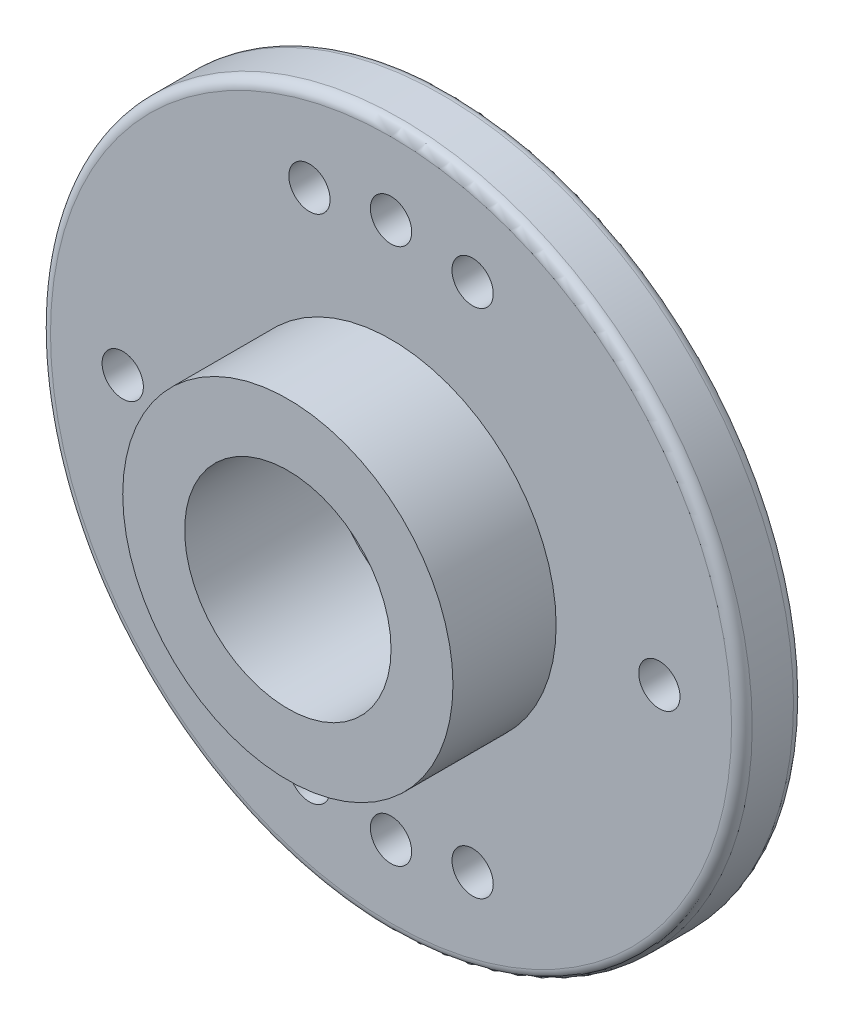
from build123d import *

# Parameters (mm, degrees)
SKETCH1_R           = 8.5
SKETCH1_R_2         = 4
SKETCH1_R_3         = 0.5
SKETCH1_R_4         = 3.5
SKETCH1_R_5         = 3
SKETCH1_R_6         = 2.5
SKETCH1_R_7         = 1.25
BOSS_EXTRUDE1_DEPTH = 0.5
SKETCH1_4_R         = 8.5
SKETCH1_4_R_2       = 4
SKETCH1_4_R_3       = 0.5
SKETCH1_4_R_4       = 3.5
SKETCH1_4_R_5       = 3
SKETCH1_4_R_6       = 2.5
BOSS_EXTRUDE2_DEPTH = 1.5
SKETCH1_5_R         = 4
SKETCH1_5_R_2       = 3.5
SKETCH1_5_R_3       = 3
SKETCH1_5_R_4       = 2.5
BOSS_EXTRUDE3_DEPTH = 4
SKETCH1_6_R         = 3.5
SKETCH1_6_R_2       = 3
BOSS_EXTRUDE4_DEPTH = 1
FILLET1_R           = 0.25


with BuildPart() as part:
    # Sketch1 → Boss-Extrude1 (new body)
    # profile 1 of 5: a face of its own
    with BuildSketch(Plane.XY):
        Circle(SKETCH1_R)
        Circle(SKETCH1_R_2, mode=Mode.SUBTRACT)
        with Locations((1.976189627, -6.192307692)):
            Circle(SKETCH1_R_3, mode=Mode.SUBTRACT)
        with Locations((-1.976189627, -6.192307692)):
            Circle(SKETCH1_R_3, mode=Mode.SUBTRACT)
        with Locations((1.976189627, 6.192307692)):
            Circle(SKETCH1_R_3, mode=Mode.SUBTRACT)
        with Locations((-1.976189627, 6.192307692)):
            Circle(SKETCH1_R_3, mode=Mode.SUBTRACT)
        with Locations((6.5, 0)):
            Circle(SKETCH1_R_3, mode=Mode.SUBTRACT)
        with Locations((-6.5, 0)):
            Circle(SKETCH1_R_3, mode=Mode.SUBTRACT)
        with Locations((0, -6.5)):
            Circle(SKETCH1_R_3, mode=Mode.SUBTRACT)
        with Locations((0, 6.5)):
            Circle(SKETCH1_R_3, mode=Mode.SUBTRACT)
    # profile 2 of 5: a face of its own
    with BuildSketch(Plane.XY):
        Circle(SKETCH1_R_2)
        Circle(SKETCH1_R_4, mode=Mode.SUBTRACT)
    # profile 3 of 5: a face of its own
    with BuildSketch(Plane.XY):
        Circle(SKETCH1_R_4)
        Circle(SKETCH1_R_5, mode=Mode.SUBTRACT)
    # profile 4 of 5: a face of its own
    with BuildSketch(Plane.XY):
        Circle(SKETCH1_R_5)
        Circle(SKETCH1_R_6, mode=Mode.SUBTRACT)
    # profile 5 of 5: a face of its own
    with BuildSketch(Plane.XY):
        Circle(SKETCH1_R_6)
        Circle(SKETCH1_R_7, mode=Mode.SUBTRACT)
    extrude(amount=BOSS_EXTRUDE1_DEPTH)

    # Sketch1<4> → Boss-Extrude2 (add)
    # profile 1 of 4: a face of its own
    with BuildSketch(Plane.XY):
        Circle(SKETCH1_4_R)
        Circle(SKETCH1_4_R_2, mode=Mode.SUBTRACT)
        with Locations((1.976189627, -6.192307692)):
            Circle(SKETCH1_4_R_3, mode=Mode.SUBTRACT)
        with Locations((-1.976189627, -6.192307692)):
            Circle(SKETCH1_4_R_3, mode=Mode.SUBTRACT)
        with Locations((1.976189627, 6.192307692)):
            Circle(SKETCH1_4_R_3, mode=Mode.SUBTRACT)
        with Locations((-1.976189627, 6.192307692)):
            Circle(SKETCH1_4_R_3, mode=Mode.SUBTRACT)
        with Locations((6.5, 0)):
            Circle(SKETCH1_4_R_3, mode=Mode.SUBTRACT)
        with Locations((-6.5, 0)):
            Circle(SKETCH1_4_R_3, mode=Mode.SUBTRACT)
        with Locations((0, -6.5)):
            Circle(SKETCH1_4_R_3, mode=Mode.SUBTRACT)
        with Locations((0, 6.5)):
            Circle(SKETCH1_4_R_3, mode=Mode.SUBTRACT)
    # profile 2 of 4: a face of its own
    with BuildSketch(Plane.XY):
        Circle(SKETCH1_4_R_2)
        Circle(SKETCH1_4_R_4, mode=Mode.SUBTRACT)
    # profile 3 of 4: a face of its own
    with BuildSketch(Plane.XY):
        Circle(SKETCH1_4_R_4)
        Circle(SKETCH1_4_R_5, mode=Mode.SUBTRACT)
    # profile 4 of 4: a face of its own
    with BuildSketch(Plane.XY):
        Circle(SKETCH1_4_R_5)
        Circle(SKETCH1_4_R_6, mode=Mode.SUBTRACT)
    extrude(amount=BOSS_EXTRUDE2_DEPTH)

    # Sketch1<5> → Boss-Extrude3 (add)
    # profile 1 of 3: a face of its own
    with BuildSketch(Plane.XY):
        Circle(SKETCH1_5_R)
        Circle(SKETCH1_5_R_2, mode=Mode.SUBTRACT)
    # profile 2 of 3: a face of its own
    with BuildSketch(Plane.XY):
        Circle(SKETCH1_5_R_2)
        Circle(SKETCH1_5_R_3, mode=Mode.SUBTRACT)
    # profile 3 of 3: a face of its own
    with BuildSketch(Plane.XY):
        Circle(SKETCH1_5_R_3)
        Circle(SKETCH1_5_R_4, mode=Mode.SUBTRACT)
    extrude(amount=BOSS_EXTRUDE3_DEPTH)

    # Sketch1<6> → Boss-Extrude4 (add)
    with BuildSketch(Plane.XY):
        Circle(SKETCH1_6_R)
        Circle(SKETCH1_6_R_2, mode=Mode.SUBTRACT)
    extrude(amount=-BOSS_EXTRUDE4_DEPTH)

    # Fillet1
    fillet1_edges = [part.edges().sort_by_distance(p)[0] for p in [
        (-8.5, 0, 0),
        (-8.5, 0, 1.5),
        (-3.5, 0, -1),
        (-3, 0, -1),
    ]]
    fillet(fillet1_edges, radius=FILLET1_R - 0.0001)  # a hair under: the kernel refuses the full size


solid = part.part
